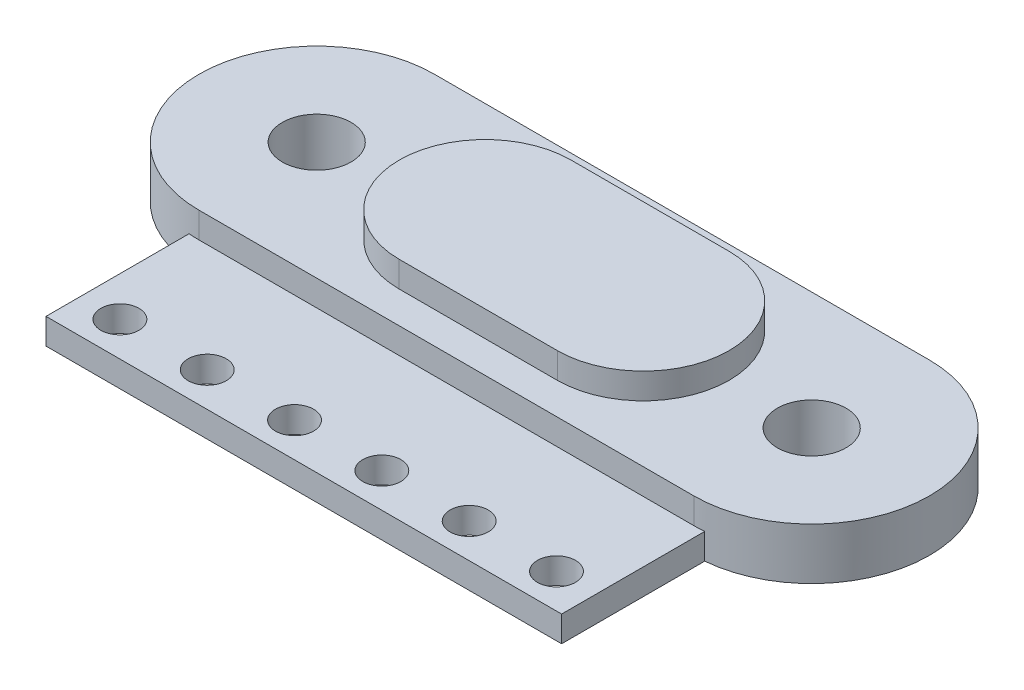
from build123d import *

# Parameters (mm, degrees)
SKETCH_2_R      = 1
SKETCH_2_R_2    = 0.554445532
EXTRUDE_3_DEPTH = 0.75
SKETCH_2_5_R    = 1
EXTRUDE_4_DEPTH = 1.5
EXTRUDE_5_DEPTH = 0.75


with BuildPart() as part:
    # 草图2 → 凸台-拉伸3 (new body)
    with BuildSketch(Plane(origin=(0, 0, 0), x_dir=(1, 0, 0), z_dir=(0, 1, 0))):
        with BuildLine():
            Line((0, 3.425), (-14.4, 3.425))
            ThreePointArc((-14.4, 3.425), (-17.821707421, 0.150144339), (-14.7, -3.411836016))
            Line((-14.7, -3.411836016), (-14.7, -7.575))
            Line((-14.7, -7.575), (0.3, -7.575))
            Line((0.3, -7.575), (0.3, -3.411836016))
            ThreePointArc((0.3, -3.411836016), (3.421707421, 0.150144339), (0, 3.425))
        make_face()
        with Locations((-14.4, 0)):
            Circle(SKETCH_2_R, mode=Mode.SUBTRACT)
        Circle(SKETCH_2_R, mode=Mode.SUBTRACT)
        with Locations((-5.93, -6.575)):
            Circle(SKETCH_2_R_2, mode=Mode.SUBTRACT)
        with Locations((-3.39, -6.575)):
            Circle(SKETCH_2_R_2, mode=Mode.SUBTRACT)
        with Locations((-0.85, -6.575)):
            Circle(SKETCH_2_R_2, mode=Mode.SUBTRACT)
        with Locations((-13.55, -6.575)):
            Circle(SKETCH_2_R_2, mode=Mode.SUBTRACT)
        with Locations((-11.01, -6.575)):
            Circle(SKETCH_2_R_2, mode=Mode.SUBTRACT)
        with Locations((-8.47, -6.575)):
            Circle(SKETCH_2_R_2, mode=Mode.SUBTRACT)
    extrude(amount=EXTRUDE_3_DEPTH)

    # 草图2<5> → 凸台-拉伸4 (add)
    with BuildSketch(Plane(origin=(0, 0, 0), x_dir=(1, 0, 0), z_dir=(0, 1, 0))):
        with BuildLine():
            Line((0, 3.425), (-14.4, 3.425))
            ThreePointArc((-14.4, 3.425), (-17.821707421, 0.150144339), (-14.7, -3.411836016))
            ThreePointArc((-14.7, -3.411836016), (-14.550144339, -3.421707421), (-14.4, -3.425))
            Line((-14.4, -3.425), (0, -3.425))
            ThreePointArc((0, -3.425), (0.150144339, -3.421707421), (0.3, -3.411836016))
            ThreePointArc((0.3, -3.411836016), (3.421707421, 0.150144339), (0, 3.425))
        make_face()
        with Locations((-14.4, 0)):
            Circle(SKETCH_2_5_R, mode=Mode.SUBTRACT)
        Circle(SKETCH_2_5_R, mode=Mode.SUBTRACT)
    extrude(amount=EXTRUDE_4_DEPTH)

    # 草图3 → 凸台-拉伸5 (add)
    with BuildSketch(Plane(origin=(0, 1.5, 0), x_dir=(1, 0, 0), z_dir=(0, 1, 0))):
        with BuildLine():
            Line((-9.5, 2.5), (-4.9, 2.5))
            ThreePointArc((-4.9, 2.5), (-2.4, 0), (-4.9, -2.5))
            Line((-4.9, -2.5), (-9.5, -2.5))
            ThreePointArc((-9.5, -2.5), (-12, 0), (-9.5, 2.5))
        make_face()
    extrude(amount=EXTRUDE_5_DEPTH)


solid = part.part
